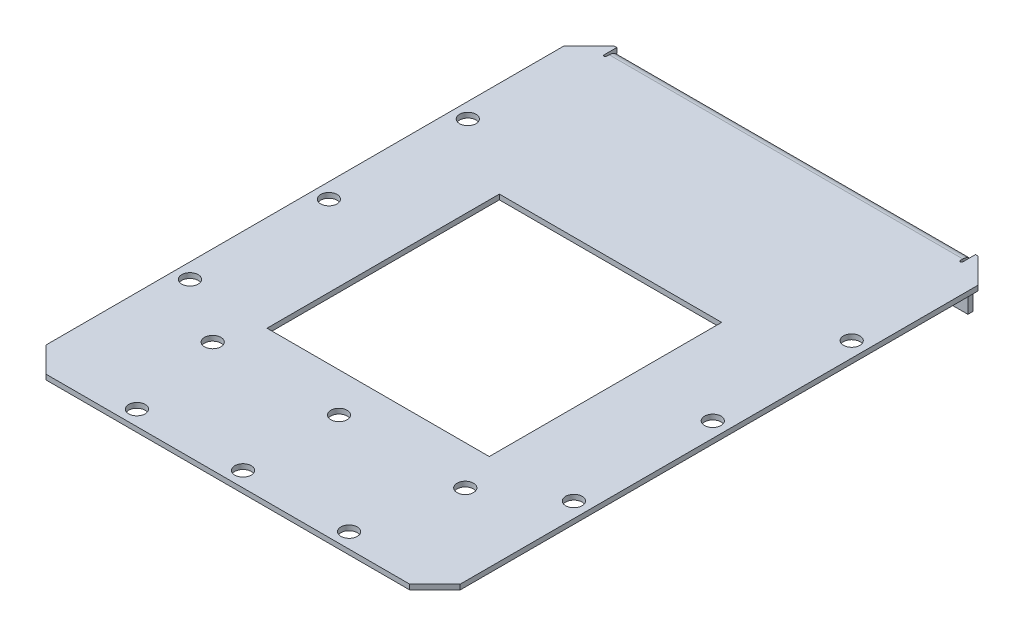
from build123d import *

# Parameters (mm, degrees)
SKETCH_1_W                   = 164
SKETCH_1_H                   = 225
SM_BASE_FLANGE_1_DEPTH       = 2
SM_START                     = -2
SM_EDGE_FLANGE_1_DEPTH       = 5
SM_START_2                   = -18
SM_EDGE_FLANGE_1_2_OUTLINE_W = 140
SM_EDGE_FLANGE_1_2_OUTLINE_H = 2
SM_EDGE_FLANGE_1_2_DEPTH     = 16
SM_START_3                   = -70
SM_EDGE_FLANGE_1_3_DEPTH     = 140
SM_EDGE_FLANGE_1_4_DEPTH     = 140
HOLE_WIZARD_M61_AT_2_COUNT   = 2
HOLE_WIZARD_M61_AT_2_PITCH   = 50
HOLE_WIZARD_M61_AT_3_COUNT   = 2
HOLE_WIZARD_M61_AT_3_PITCH   = 50
HOLE_WIZARD_M61_2_D          = 6.5
CUT_EXTRUDE_1_REACH          = 148.302
SKETCH_10_W                  = 88
SKETCH_10_H                  = 92
CHAMFER_1_SIZE               = 10


with BuildPart() as part:
    # Базовая кромка1: sheet metal written as solids
    # Sketch 1 → Базовая кромка1 (new body)
    with BuildSketch(Plane(origin=(0, 0, 0), x_dir=(1, 0, 0), z_dir=(0, 1, 0))):
        with Locations((0, 7)):
            Rectangle(SKETCH_1_W, SKETCH_1_H)
    extrude(amount=SM_BASE_FLANGE_1_DEPTH)

    # Ребро-кромка1: read off the stored shape, not the designer's step
    # Ребро-кромка1 outline → Ребро-кромка1 (cut)
    with BuildSketch(Plane(origin=(0, 0, 0), x_dir=(1, 0, 0), z_dir=(0, 1, 0)).offset(SM_START)):
        with BuildLine():
            Line((-70, 114.5), (-70, 119.5))
            Line((-70, 119.5), (-71, 119.5))
            Line((-71, 119.5), (-71, 114.5))
            ThreePointArc((-71, 114.5), (-70.5, 114), (-70, 114.5))
        make_face()
        with BuildLine():
            Line((71, 119.5), (70, 119.5))
            Line((70, 119.5), (70, 114.5))
            ThreePointArc((70, 114.5), (70.5, 114), (71, 114.5))
            Line((71, 114.5), (71, 119.5))
        make_face()
    extrude(amount=SM_EDGE_FLANGE_1_DEPTH, mode=Mode.SUBTRACT)

    # Sm Edge Flange 1 3 outline → Sm Edge Flange 1 3 (cut)
    with BuildSketch(Plane.YZ.offset(SM_START_3)):
        with BuildLine():
            ThreePointArc((2, -115.5), (1.464101615, -117.5), (0, -118.964101616))
            Line((0, -118.964101616), (0, -119.5))
            Line((0, -119.5), (2, -119.5))
            Line((2, -119.5), (2, -115.5))
        make_face()
    extrude(amount=SM_EDGE_FLANGE_1_3_DEPTH, mode=Mode.SUBTRACT)



with BuildPart() as body_2:
    # Sm Edge Flange 1 2 outline → Sm Edge Flange 1 2 (new body)
    with BuildSketch(Plane(origin=(0, 0, 0), x_dir=(1, 0, 0), z_dir=(0, 1, 0)).offset(SM_START_2)):
        with Locations((0, 118.5)):
            Rectangle(SM_EDGE_FLANGE_1_2_OUTLINE_W, SM_EDGE_FLANGE_1_2_OUTLINE_H)
    extrude(amount=SM_EDGE_FLANGE_1_2_DEPTH)


with BuildPart() as part_1:
    add(part.part)

    add(body_2.part)  # Sm Edge Flange 1 4 merges body 2
    # Sm Edge Flange 1 4 outline → Sm Edge Flange 1 4 (add)
    with BuildSketch(Plane.YZ.offset(SM_START_3)):
        with BuildLine():
            Line((-2, -117.5), (-2, -119.5))
            ThreePointArc((-2, -119.5), (-0.96472382, -119.363703305), (0, -118.964101616))
            Line((0, -118.964101616), (0, -115.5))
            ThreePointArc((0, -115.5), (-0.585786438, -116.914213562), (-2, -117.5))
        make_face()
    extrude(amount=SM_EDGE_FLANGE_1_4_DEPTH)

    # Эскиз7 → Hole Wizard M61 (revolve, cut)
    with BuildSketch(Plane(origin=(0, -10, -119.5), x_dir=(0, 1, 0), z_dir=(1, 0, 0))):
        Polygon((0, 0), (0, 2), (4.5, 2), (4.5, 1.5), (6, 0), align=None)
    hole_wizard_m61 = revolve(axis=Axis((0, -10, -125.85), (0, 0, 1)), mode=Mode.SUBTRACT)

    # Hole Wizard M61 at 2: Hole Wizard M61 ×2
    with Locations(*[(i * HOLE_WIZARD_M61_AT_2_PITCH, 0, 0) for i in range(1, HOLE_WIZARD_M61_AT_2_COUNT)]):
        add(hole_wizard_m61, mode=Mode.SUBTRACT)

    # Hole Wizard M61 at 3: Hole Wizard M61 ×2
    with Locations(*[(-i * HOLE_WIZARD_M61_AT_3_PITCH, 0, 0) for i in range(1, HOLE_WIZARD_M61_AT_3_COUNT)]):
        add(hole_wizard_m61, mode=Mode.SUBTRACT)

    # Hole Wizard M61 2 (through all)
    with Locations(Plane(origin=(-76, 2, 44.5), x_dir=(0, 0, 1), z_dir=(0, 1, 0))):
        with Locations((0, 0), (-110, 0), (-110, 152), (0, 152), (17, 126), (17, 26), (55, 34), (55, 118), (55, 76), (17, 76), (-55, 152), (-55, 0)):
            Hole(HOLE_WIZARD_M61_2_D / 2)

    # Эскиз10 → Вытянуть1 (cut, up to next)
    with BuildSketch(Plane(origin=(0, 2, 0), x_dir=(1, 0, 0), z_dir=(0, 1, 0)), mode=Mode.PRIVATE) as cut_extrude_1_sk1:
        Rectangle(SKETCH_10_W, SKETCH_10_H)
    cut_extrude_1_tool1 = extrude(cut_extrude_1_sk1.sketch, amount=-CUT_EXTRUDE_1_REACH, mode=Mode.PRIVATE) & part_1.part
    add(cut_extrude_1_tool1.solids().sort_by_distance((0, 2, 0))[0], mode=Mode.SUBTRACT)

    # Фаска1
    chamfer_1_edges = [part_1.edges().sort_by_distance(p)[0] for p in [
        (-82, 1, -119.5),
        (82, 1, -119.5),
        (82, 1, 105.5),
        (-82, 1, 105.5),
    ]]
    chamfer(chamfer_1_edges, length=CHAMFER_1_SIZE)


solid = part_1.part
